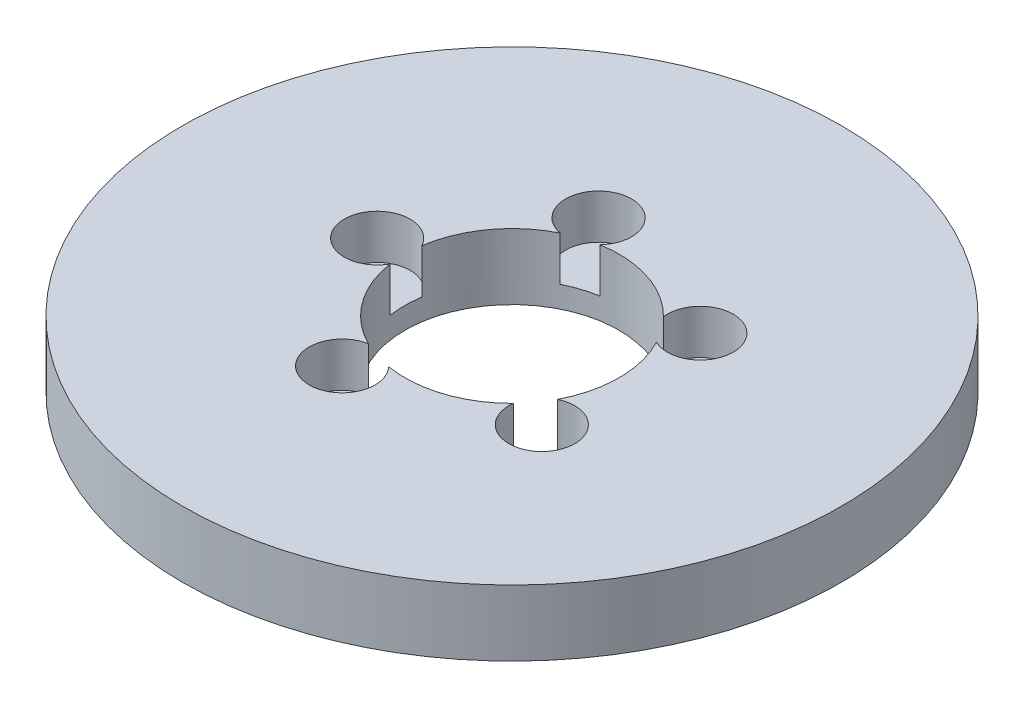
from build123d import *

# Parameters (mm, degrees)
SKETCH1_R           = 100
BOSS_EXTRUDE1_DEPTH = 20
SKETCH2_R           = 32.5
CUT_EXTRUDE1_DEPTH  = 143.828568571
SKETCH3_R           = 10
CUT_EXTRUDE2_DEPTH  = 13.47385129
CIRPATTERN1_COUNT   = 5


with BuildPart() as part:
    # Sketch1 → Boss-Extrude1 (new body)
    with BuildSketch(Plane(origin=(0, 0, 0), x_dir=(1, 0, 0), z_dir=(0, 1, 0))):
        Circle(SKETCH1_R)
    extrude(amount=BOSS_EXTRUDE1_DEPTH)

    # Sketch2 → Cut-Extrude1 (cut, through all)
    with BuildSketch(Plane(origin=(0, 0, 0), x_dir=(1, 0, 0), z_dir=(0, 1, 0))):
        Circle(SKETCH2_R)
    extrude(amount=CUT_EXTRUDE1_DEPTH, mode=Mode.SUBTRACT)

    # Sketch3 → Cut-Extrude2 (cut)
    with BuildSketch(Plane(origin=(0, 20, 0), x_dir=(1, 0, 0), z_dir=(0, 1, 0))):
        with Locations((-40.914100101, 0)):
            Circle(SKETCH3_R)
    cut_extrude2 = extrude(amount=-CUT_EXTRUDE2_DEPTH, mode=Mode.SUBTRACT)

    # CirPattern1: Cut-Extrude2 ×5 about axis
    cirpattern1_axis = Axis((0, 0, 0), (0, 1, 0))
    for i in range(1, CIRPATTERN1_COUNT):
        add(cut_extrude2.rotate(cirpattern1_axis, i * 360 / CIRPATTERN1_COUNT), mode=Mode.SUBTRACT)


solid = part.part
